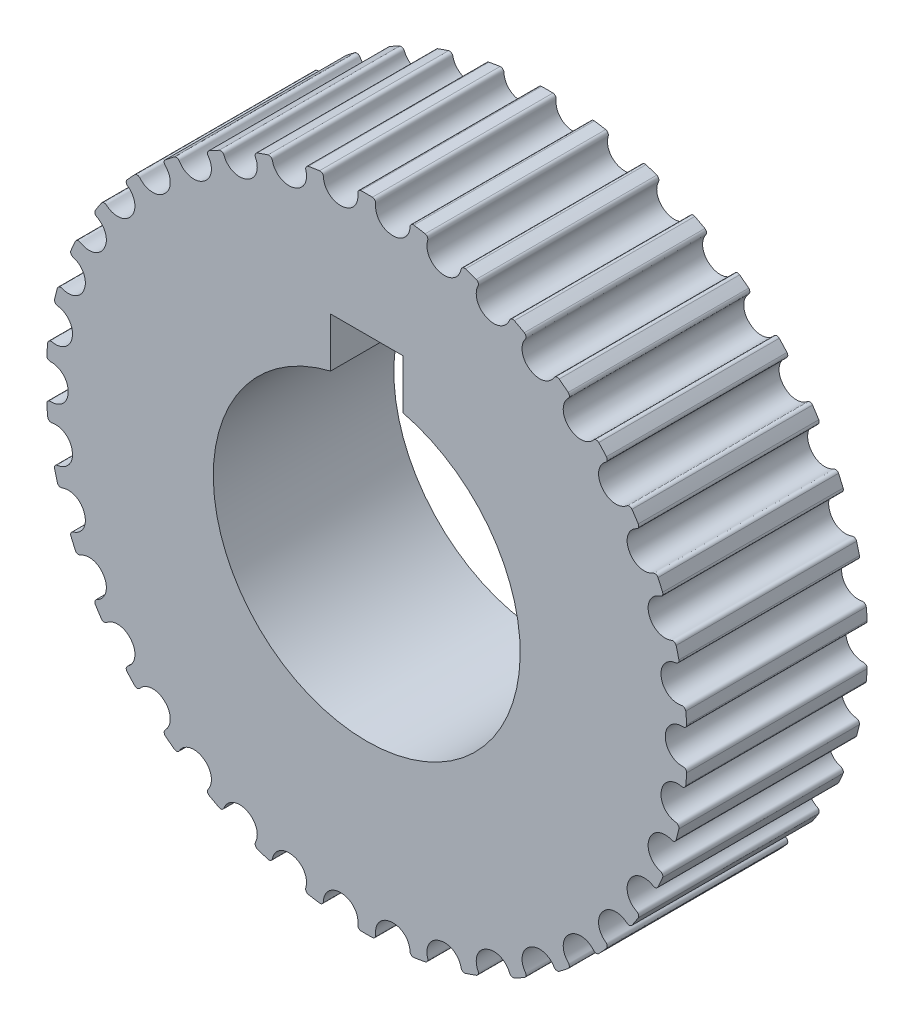
from build123d import *

# Parameters (mm, degrees)
TOOTHEXTRUDECUTGEARBELT01_DEPTH = 8.2296
PATTERNGEARBELT01_COUNT         = 38
BOREREVOLVESKETCH_W             = 19.5072
BOREREVOLVESKETCH_H             = 6.35
CUT_EXTRUDE_2_DEPTH             = 30.439215593
CUT_EXTRUDE_2_DEPTH_BACK        = 30.439215593
SKETCH_6_W                      = 23.542850768
SKETCH_6_H                      = 49.661884298
SKETCH_6_W_2                    = 10
SKETCH_6_H_2                    = 42.17926945
SKETCH_7_R                      = 19
SKETCH_7_R_2                    = 11
EXTRUDE_2_DEPTH                 = 1.5
SKETCH_8_R                      = 11
CUT_EXTRUDE_3_DEPTH             = 23.5
SKETCH_9_R                      = 11
SKETCH_9_R_2                    = 10
EXTRUDE_3_DEPTH                 = 13
CUT_EXTRUDE_START               = -19.0000001
CUT_EXTRUDE_4_OUTLINE_W         = 42
CUT_EXTRUDE_4_OUTLINE_H         = 1.5
CUT_EXTRUDE_4_DEPTH             = 38.0000001
EXTRUDE_START                   = -10
SKETCH_11_R                     = 10
EXTRUDE_4_DEPTH                 = 10
SKETCH_13_R                     = 3
CUT_EXTRUDE_6_DEPTH             = 28.011263736
SKETCH_14_R                     = 8.5
CUT_EXTRUDE_7_DEPTH             = 28.011263736
SKETCH_15_W                     = 4
SKETCH_15_H                     = 4.13606683
CUT_EXTRUDE_8_DEPTH             = 10
CHAMFER_1_SIZE                  = 0.2


# Read off the part's stored shape, not the designer's step: 切除-拉伸4
with BuildPart() as part:
    # SketchRevolveGearBelt01 → GearBelt01 (revolve)
    with BuildSketch(Plane(origin=(0, 0, 0), x_dir=(0, 0, -1), z_dir=(1, 0, 0)), mode=Mode.PRIVATE) as gearbelt01_sk:
        Polygon((9.7536, 0), (9.7536, 17.126361048), (8.9916, 17.126361048), (8.9916, 17.990789824), (9.554336648, 19.349356273), (8.850340445, 19.640961048), (8.2296, 18.142361048), (8.2296, 17.761361048), (-8.2296, 17.761361048), (-8.2296, 18.142361048), (-8.850340445, 19.640961048), (-9.554336648, 19.349356273), (-8.9916, 17.990789824), (-8.9916, 17.126361048), (-9.7536, 17.126361048), (-9.7536, 0), align=None)
    revolve(gearbelt01_sk.sketch.rotate(Axis((0, 0, 0), (0, 0, -1)), 90), axis=Axis((0, 0, 0), (0, 0, -1)))

    # SketchToothGearBelt01 → ToothExtrudeCutGearBelt01 (cut, symmetric)
    with BuildSketch(Plane.XY):
        with BuildLine():
            ThreePointArc((17.723656193, 1.158614958), (17.76148579, 0), (17.723656193, -1.158614958))
            add(Edge.make_bspline(
                [(17.723656193, -1.158614958), (17.724335676, -1.14823627), (17.724077281, -1.132585151), (17.721194158, -1.111966732), (17.717777417, -1.096730895), (17.713128932, -1.081824634), (17.707279735, -1.067347346), (17.70026882, -1.05339557), (17.692142941, -1.040062338), (17.682956281, -1.027436561), (17.672770099, -1.015602429), (17.66165232, -1.004638853), (17.649677079, -0.994618949), (17.63692423, -0.9856095), (17.62347881, -0.977670704), (17.60943048, -0.970855044), (17.594872907, -0.96520967), (17.579903201, -0.960765872), (17.564621042, -0.957576996), (17.549128869, -0.95557581), (17.516665111, -0.954598043), (17.465194615, -0.955658717), (17.394665001, -0.952974324), (17.322442429, -0.94419054), (17.251120537, -0.929864538), (17.181142601, -0.909971652), (17.112937405, -0.88466435), (17.046924504, -0.854090084), (16.983509536, -0.818438939), (16.923082288, -0.777929454), (16.866014153, -0.732810765), (16.812655887, -0.683360139), (16.76333544, -0.629881524), (16.718355954, -0.572703607), (16.677993853, -0.512177819), (16.642497327, -0.44867616), (16.612084116, -0.382588948), (16.586942746, -0.314322278), (16.567221777, -0.244296084), (16.553064674, -0.172939449), (16.544475394, -0.100695852), (16.542532207, -0.047557361), (16.542623513, -0.014000083), (16.542610816, 0), (16.542623513, 0.014000083), (16.542532207, 0.047557361), (16.544475394, 0.100695852), (16.553064674, 0.172939449), (16.567221777, 0.244296084), (16.586942746, 0.314322278), (16.612084116, 0.382588948), (16.642497327, 0.44867616), (16.677993853, 0.512177819), (16.718355954, 0.572703607), (16.76333544, 0.629881524), (16.812655887, 0.683360139), (16.866014153, 0.732810765), (16.923082288, 0.777929454), (16.983509536, 0.818438939), (17.046924504, 0.854090084), (17.112937405, 0.88466435), (17.181142601, 0.909971652), (17.251120537, 0.929864538), (17.322442429, 0.94419054), (17.394665001, 0.952974324), (17.465194615, 0.955658717), (17.516665111, 0.954598043), (17.549128869, 0.95557581), (17.564621042, 0.957576996), (17.579903201, 0.960765872), (17.594872907, 0.96520967), (17.60943048, 0.970855044), (17.62347881, 0.977670704), (17.63692423, 0.9856095), (17.649677079, 0.994618949), (17.66165232, 1.004638853), (17.672770099, 1.015602429), (17.682956281, 1.027436561), (17.692142941, 1.040062338), (17.70026882, 1.05339557), (17.707279735, 1.067347346), (17.713128932, 1.081824634), (17.717777417, 1.096730895), (17.721194158, 1.111966732), (17.724077281, 1.132585151), (17.724335676, 1.14823627), (17.723656193, 1.158614958)],
                knots=[0, 0, 0, 0, 0.008387202, 0.012580803, 0.016774404, 0.020968005, 0.025161606, 0.029355207, 0.033548808, 0.037742409, 0.04193601, 0.046129611, 0.050323212, 0.054516813, 0.058710414, 0.062904015, 0.067097616, 0.071291217, 0.075484818, 0.079678419, 0.08387202, 0.101664119, 0.121204489, 0.14074486, 0.16028523, 0.179825601, 0.199365971, 0.218906342, 0.238446712, 0.257987083, 0.277527453, 0.297067824, 0.316608194, 0.336148565, 0.355688935, 0.375229306, 0.394769676, 0.414310047, 0.433850417, 0.453390788, 0.472931158, 0.492471529, 0.496235765, 0.5, 0.503764235, 0.507528471, 0.527068842, 0.546609212, 0.566149583, 0.585689953, 0.605230324, 0.624770694, 0.644311065, 0.663851435, 0.683391806, 0.702932176, 0.722472547, 0.742012917, 0.761553288, 0.781093658, 0.800634029, 0.820174399, 0.83971477, 0.85925514, 0.878795511, 0.898335881, 0.91612798, 0.920321581, 0.924515182, 0.928708783, 0.932902384, 0.937095985, 0.941289586, 0.945483187, 0.949676788, 0.953870389, 0.95806399, 0.962257591, 0.966451192, 0.970644793, 0.974838394, 0.979031995, 0.983225596, 0.987419197, 0.991612798, 1, 1, 1, 1], degree=3))
        make_face()
    toothextrudecutgearbelt01 = extrude(amount=TOOTHEXTRUDECUTGEARBELT01_DEPTH, both=True, mode=Mode.SUBTRACT)

    # PatternGearBelt01: ToothExtrudeCutGearBelt01 ×38 about axis
    patterngearbelt01_axis = Axis((0, 0, 55), (0, 0, -1))
    for i in range(1, PATTERNGEARBELT01_COUNT):
        add(toothextrudecutgearbelt01.rotate(patterngearbelt01_axis, i * 360 / PATTERNGEARBELT01_COUNT), mode=Mode.SUBTRACT)

    # BoreRevolveSketch → BoreRevolveCut (revolve, cut)
    with BuildSketch(Plane(origin=(0, 0, 0), x_dir=(0, 0, -1), z_dir=(1, 0, 0)), mode=Mode.PRIVATE) as borerevolvecut_sk:
        with Locations((0, 3.175)):
            Rectangle(BOREREVOLVESKETCH_W, BOREREVOLVESKETCH_H)
    revolve(borerevolvecut_sk.sketch.rotate(Axis((0, 0, 0), (0, 0, -1)), 90), axis=Axis((0, 0, 0), (0, 0, -1)), mode=Mode.SUBTRACT)

    # 草图6 → 切除-拉伸2 (cut, two sides: drawn at the far end of the back side and taken through both)
    with BuildSketch(Plane(origin=(0, 0, 0), x_dir=(0, 0, -1), z_dir=(1, 0, 0)).offset(-CUT_EXTRUDE_2_DEPTH_BACK)):
        Rectangle(SKETCH_6_W, SKETCH_6_H)
        Rectangle(SKETCH_6_W_2, SKETCH_6_H_2, mode=Mode.SUBTRACT)
    extrude(amount=CUT_EXTRUDE_2_DEPTH + CUT_EXTRUDE_2_DEPTH_BACK, mode=Mode.SUBTRACT)

    # 草图7 → 凸台-拉伸2 (add)
    with BuildSketch(Plane.XY.offset(5)):
        Circle(SKETCH_7_R)
        Circle(SKETCH_7_R_2, mode=Mode.SUBTRACT)
    extrude_2 = extrude(amount=EXTRUDE_2_DEPTH)

    # 镜向1: 凸台-拉伸2 across plane
    add(extrude_2.mirror(Plane.XY))

    # 草图8 → 切除-拉伸3 (cut)
    with BuildSketch(Plane.XY.offset(5)):
        Circle(SKETCH_8_R)
    extrude(amount=-CUT_EXTRUDE_3_DEPTH, mode=Mode.SUBTRACT)

    # 草图9 → 凸台-拉伸3 (add)
    with BuildSketch(Plane.XY.offset(6.5)):
        Circle(SKETCH_9_R)
        Circle(SKETCH_9_R_2, mode=Mode.SUBTRACT)
    extrude(amount=-EXTRUDE_3_DEPTH)

    # 切除-拉伸4 outline → 切除-拉伸4 (cut)
    with BuildSketch(Plane(origin=(0, 0, 0), x_dir=(1, 0, 0), z_dir=(0, 1, 0)).offset(CUT_EXTRUDE_START)):
        with Locations((0, 5.75)):
            Rectangle(CUT_EXTRUDE_4_OUTLINE_W, CUT_EXTRUDE_4_OUTLINE_H)
        with Locations((0, -5.75)):
            Rectangle(CUT_EXTRUDE_4_OUTLINE_W, CUT_EXTRUDE_4_OUTLINE_H)
    extrude(amount=CUT_EXTRUDE_4_DEPTH, mode=Mode.SUBTRACT)

    # 草图11 → 凸台-拉伸4 (add)
    with BuildSketch(Plane(origin=(0, 0, -5), x_dir=(-1, 0, 0), z_dir=(0, 0, -1)).offset(EXTRUDE_START)):
        Circle(SKETCH_11_R)
    extrude(amount=EXTRUDE_4_DEPTH)

    # 草图13 → 切除-拉伸6 (cut, through all)
    with BuildSketch(Plane(origin=(0, 0, -5), x_dir=(-1, 0, 0), z_dir=(0, 0, -1))):
        Circle(SKETCH_13_R)
    extrude(amount=-CUT_EXTRUDE_6_DEPTH, mode=Mode.SUBTRACT)

    # 草图14 → 切除-拉伸7 (cut, through all)
    with BuildSketch(Plane.XY.offset(5)):
        Circle(SKETCH_14_R)
    extrude(amount=-CUT_EXTRUDE_7_DEPTH, mode=Mode.SUBTRACT)

    # 草图15 → 切除-拉伸8 (cut)
    with BuildSketch(Plane.XY.offset(5)):
        with Locations((0, 8.931966585)):
            Rectangle(SKETCH_15_W, SKETCH_15_H)
    extrude(amount=-CUT_EXTRUDE_8_DEPTH, mode=Mode.SUBTRACT)

    # 倒角1
    chamfer_1_edges = [part.edges().sort_by_distance(p)[0] for p in [
        (2, 9.63067791, -5),
        (-2, 9.63067791, -5),
        (0, 11, -5),
    ]]
    chamfer(chamfer_1_edges, length=CHAMFER_1_SIZE)


solid = part.part
